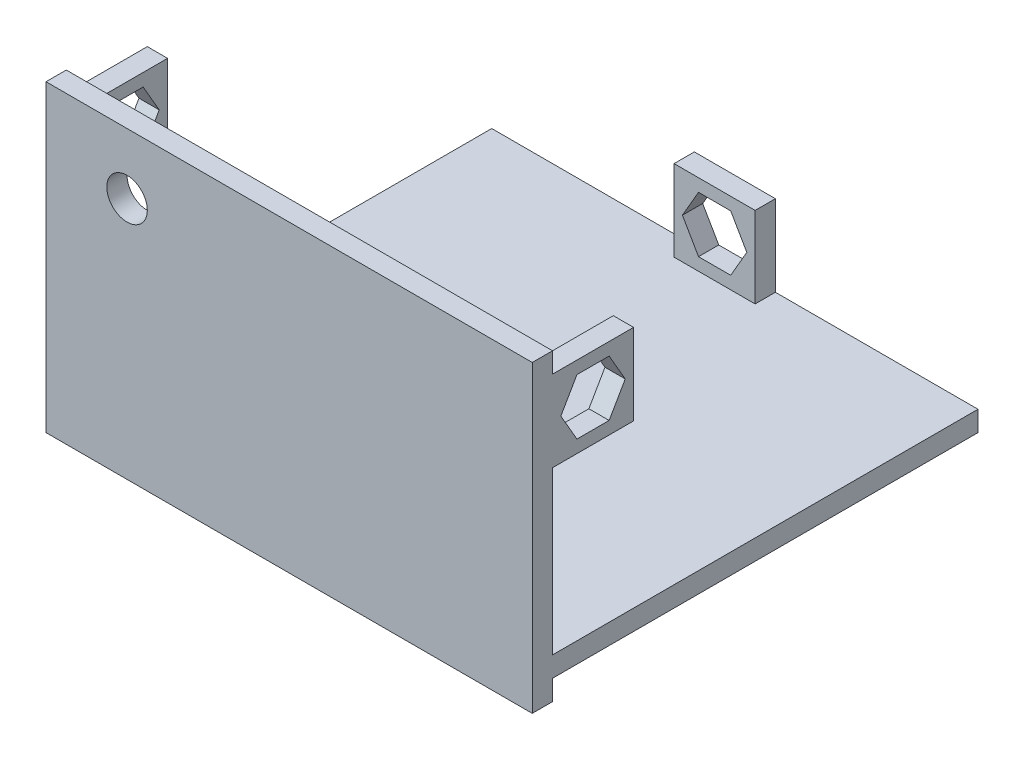
from build123d import *

# Parameters (mm, degrees)
SKETCH1_W               = 76.2
SKETCH1_H               = 47.625
BOSS_EXTRUDE1_DEPTH     = 3.175
SKETCH2_W               = 76.2
SKETCH2_H               = 3.175
BOSS_EXTRUDE2_DEPTH     = 66.675
SKETCH6_W               = 12.7
SKETCH6_H               = 12.7
BOSS_EXTRUDE4_DEPTH     = 3.175
SKETCH7_W               = 12.7
SKETCH7_H               = 12.7
BOSS_EXTRUDE5_DEPTH     = 3.175
SKETCH8_W               = 12.7
SKETCH8_H               = 12.7
BOSS_EXTRUDE6_DEPTH     = 3.175
CUT_EXTRUDE4_DEPTH      = 3.175
CUT_EXTRUDE5_DEPTH      = 105.014570043
CUT_EXTRUDE5_DEPTH_BACK = 105.014570043
SKETCH11_R              = 3.175
CUT_EXTRUDE6_DEPTH      = 3.175


with BuildPart() as part:
    # Sketch1 → Boss-Extrude1 (new body)
    with BuildSketch(Plane.XY):
        Rectangle(SKETCH1_W, SKETCH1_H)
    extrude(amount=BOSS_EXTRUDE1_DEPTH)

    # Sketch2 → Boss-Extrude2 (add)
    with BuildSketch(Plane(origin=(0, 0, 0), x_dir=(-1, 0, 0), z_dir=(0, 0, -1))):
        with Locations((0, -19.05)):
            Rectangle(SKETCH2_W, SKETCH2_H)
    extrude(amount=BOSS_EXTRUDE2_DEPTH)

    # Sketch6 → Boss-Extrude4 (add)
    with BuildSketch(Plane(origin=(38.1, 0, 0), x_dir=(0, 0, -1), z_dir=(1, 0, 0))):
        with Locations((6.35, 14.2875)):
            Rectangle(SKETCH6_W, SKETCH6_H)
    extrude(amount=-BOSS_EXTRUDE4_DEPTH)

    # Sketch7 → Boss-Extrude5 (add)
    with BuildSketch(Plane.ZY.offset(38.1)):
        with Locations((-6.35, 14.2875)):
            Rectangle(SKETCH7_W, SKETCH7_H)
    extrude(amount=-BOSS_EXTRUDE5_DEPTH)

    # Sketch8 → Boss-Extrude6 (add)
    with BuildSketch(Plane(origin=(0, 0, -66.675), x_dir=(-1, 0, 0), z_dir=(0, 0, -1))):
        with Locations((0, -11.1125)):
            Rectangle(SKETCH8_W, SKETCH8_H)
    extrude(amount=-BOSS_EXTRUDE6_DEPTH)

    # Sketch9 → Cut-Extrude4 (cut)
    with BuildSketch(Plane(origin=(0, 0, -66.675), x_dir=(-1, 0, 0), z_dir=(0, 0, -1))):
        Polygon((2.522327856, -6.7437), (-2.522327856, -6.7437), (-5.044655712, -11.1125), (-2.522327856, -15.4813), (2.522327856, -15.4813), (5.044655712, -11.1125), align=None)
    extrude(amount=-CUT_EXTRUDE4_DEPTH, mode=Mode.SUBTRACT)

    # Sketch10 → Cut-Extrude5 (cut, two sides: drawn at the far end of the back side and taken through both)
    with BuildSketch(Plane(origin=(38.1, 0, 0), x_dir=(0, 0, -1), z_dir=(1, 0, 0)).offset(-CUT_EXTRUDE5_DEPTH_BACK)):
        Polygon((11.394655712, 14.2875), (8.872327856, 18.6563), (3.827672144, 18.6563), (1.305344288, 14.2875), (3.827672144, 9.9187), (8.872327856, 9.9187), align=None)
    extrude(amount=CUT_EXTRUDE5_DEPTH + CUT_EXTRUDE5_DEPTH_BACK, mode=Mode.SUBTRACT)

    # Sketch11 → Cut-Extrude6 (cut)
    with BuildSketch(Plane.XY.offset(3.175)):
        with Locations((-25.4, 14.2875)):
            Circle(SKETCH11_R)
    extrude(amount=-CUT_EXTRUDE6_DEPTH, mode=Mode.SUBTRACT)


solid = part.part
